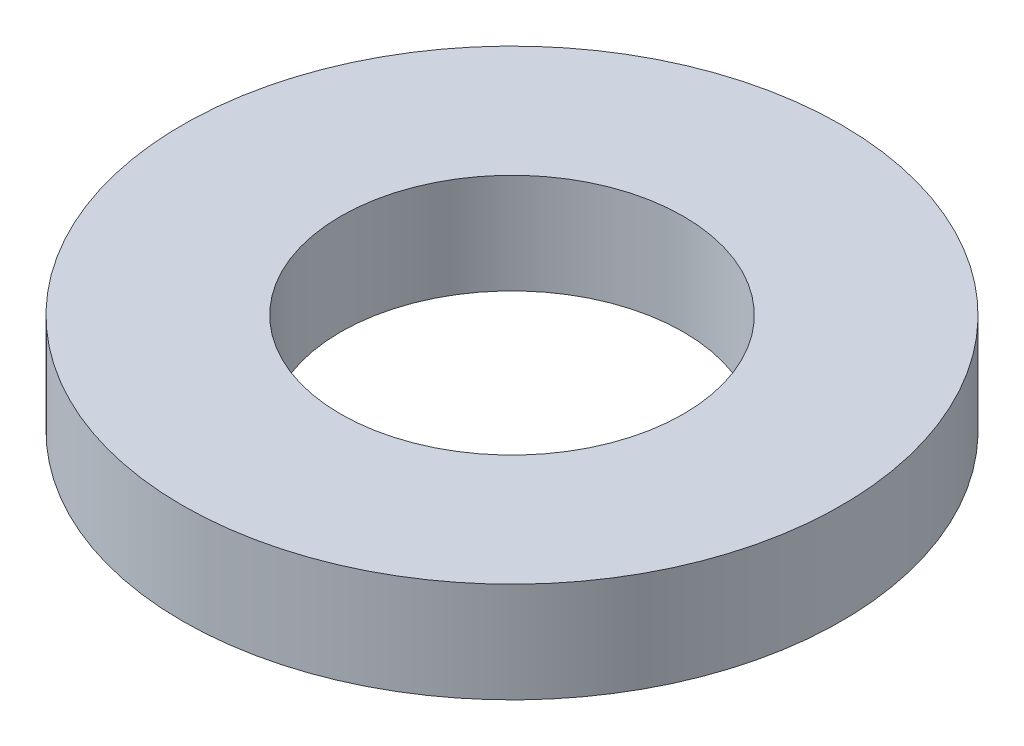
from build123d import *

# Parameters (mm, degrees)
SKETCH1_R           = 62.5
BOSS_EXTRUDE1_DEPTH = 19
SKETCH2_R           = 32.5
CUT_EXTRUDE1_DEPTH  = 91.407411201


with BuildPart() as part:
    # Sketch1 → Boss-Extrude1 (new body)
    with BuildSketch(Plane(origin=(0, 0, 0), x_dir=(1, 0, 0), z_dir=(0, 1, 0))):
        Circle(SKETCH1_R)
    extrude(amount=BOSS_EXTRUDE1_DEPTH)

    # Sketch2 → Cut-Extrude1 (cut, through all)
    with BuildSketch(Plane(origin=(0, 0, 0), x_dir=(1, 0, 0), z_dir=(0, 1, 0))):
        Circle(SKETCH2_R)
    extrude(amount=CUT_EXTRUDE1_DEPTH, mode=Mode.SUBTRACT)


solid = part.part
